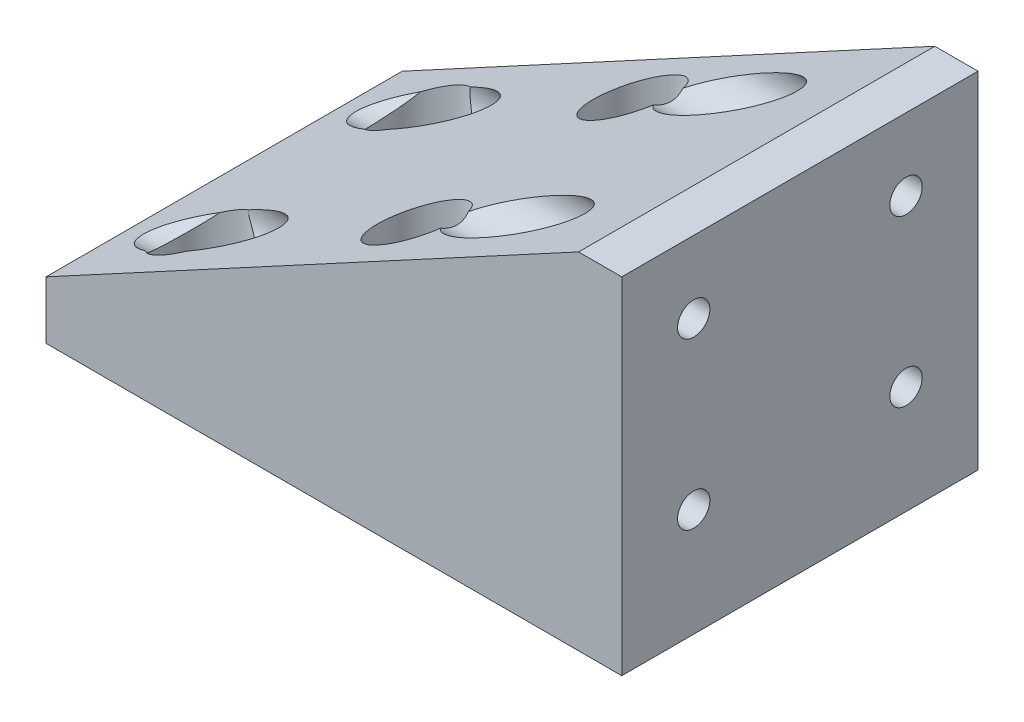
from build123d import *

# Parameters (mm, degrees)
BOSS_EXTRUDE1_DEPTH                           = 40
BOSS_EXTRUDE1_DEPTH_BACK                      = 8
SKETCH1_W                                     = 80
SKETCH1_H                                     = 49.5
CHAMFER1_SIZE                                 = 40
CHAMFER1_SIZE2                                = 74
CSK_FOR_M4_SFHCS1_AT_2_COUNT                  = 2
CSK_FOR_M4_SFHCS1_AT_2_PITCH                  = 30
CSK_FOR_M4_SFHCS1_AT_3_COUNT                  = 2
CSK_FOR_M4_SFHCS1_AT_3_PITCH                  = 42.426406871
CSK_FOR_M4_SFHCS1_AT_4_COUNT                  = 2
CSK_FOR_M4_SFHCS1_AT_4_PITCH                  = 30
SKETCH4_R                                     = 5.48
CUT_EXTRUDE1_DEPTH                            = 62.745951284
CSK_FOR_8_FLAT_HEAD_MACHINE_SCREW1_AT_2_COUNT = 2
CSK_FOR_8_FLAT_HEAD_MACHINE_SCREW1_AT_2_PITCH = 29.5
CSK_FOR_8_FLAT_HEAD_MACHINE_SCREW1_AT_3_COUNT = 2
CSK_FOR_8_FLAT_HEAD_MACHINE_SCREW1_AT_3_PITCH = 37.406550229
CSK_FOR_8_FLAT_HEAD_MACHINE_SCREW1_AT_4_COUNT = 2
CSK_FOR_8_FLAT_HEAD_MACHINE_SCREW1_AT_4_PITCH = 23
SKETCH7_R                                     = 5.0856896
CUT_EXTRUDE2_DEPTH                            = 87.842170056


with BuildPart() as part:
    # Sketch1 → Boss-Extrude1 (new, two sides: drawn at the far end of the back side and taken through both)
    with BuildSketch(Plane(origin=(0, 0, 0), x_dir=(1, 0, 0), z_dir=(0, 1, 0)).offset(-BOSS_EXTRUDE1_DEPTH_BACK)):
        Rectangle(SKETCH1_W, SKETCH1_H)
    extrude(amount=BOSS_EXTRUDE1_DEPTH + BOSS_EXTRUDE1_DEPTH_BACK)

    # Chamfer1
    chamfer1_edges = [part.edges().sort_by_distance(p)[0] for p in [
        (-40, 40, 0),
    ]]
    chamfer1_side = [part.faces().sort_by_distance(p)[0] for p in [
        (-40, 16, 0),
    ]]
    chamfer(chamfer1_edges, length=CHAMFER1_SIZE, length2=CHAMFER1_SIZE2, reference=chamfer1_side[0])

    # Sketch3 → CSK for M4 SFHCS1 (revolve, cut)
    with BuildSketch(Plane(origin=(-28.25, 0, -15), x_dir=(0, 0, 1), z_dir=(1, 0, 0))):
        Polygon((0, 0), (0, 8), (2.25, 8), (2.25, 3.23), (5.48, 0), align=None)
    csk_for_m4_sfhcs1 = revolve(axis=Axis((-28.25, 6.35, -15), (0, -1, 0)), mode=Mode.SUBTRACT)

    # CSK for M4 SFHCS1 at 2: CSK for M4 SFHCS1 ×2
    with Locations(*[(i * CSK_FOR_M4_SFHCS1_AT_2_PITCH, 0, 0) for i in range(1, CSK_FOR_M4_SFHCS1_AT_2_COUNT)]):
        add(csk_for_m4_sfhcs1, mode=Mode.SUBTRACT)

    # CSK for M4 SFHCS1 at 3: CSK for M4 SFHCS1 ×2
    with Locations(*[Vector(0.7071067811865476, 0, 0.7071067811865476) * (i * CSK_FOR_M4_SFHCS1_AT_3_PITCH) for i in range(1, CSK_FOR_M4_SFHCS1_AT_3_COUNT)]):
        add(csk_for_m4_sfhcs1, mode=Mode.SUBTRACT)

    # CSK for M4 SFHCS1 at 4: CSK for M4 SFHCS1 ×2
    with Locations(*[(0, 0, i * CSK_FOR_M4_SFHCS1_AT_4_PITCH) for i in range(1, CSK_FOR_M4_SFHCS1_AT_4_COUNT)]):
        add(csk_for_m4_sfhcs1, mode=Mode.SUBTRACT)

    # Sketch4 → Cut-Extrude1 (cut, through all)
    with BuildSketch(Plane.XZ):
        with Locations((-28.25, -15)):
            Circle(SKETCH4_R)
        with Locations((1.75, -15)):
            Circle(SKETCH4_R)
        with Locations((1.75, 15)):
            Circle(SKETCH4_R)
        with Locations((-28.25, 15)):
            Circle(SKETCH4_R)
    extrude(amount=-CUT_EXTRUDE1_DEPTH, mode=Mode.SUBTRACT)

    # Sketch6 → CSK for #8 Flat Head Machine Screw1 (revolve, cut)
    with BuildSketch(Plane(origin=(33, 30, 14.75), x_dir=(0, 0, 1), z_dir=(0, 1, 0))):
        Polygon((0, 0), (0, 7), (2.2479, 7), (2.2479, 3.264503502), (5.0856896, 0), align=None)
    csk_for_8_flat_head_machine_screw1 = revolve(axis=Axis((26.65, 30, 14.75), (1, 0, 0)), mode=Mode.SUBTRACT)

    # CSK for #8 Flat Head Machine Screw1 at 2: CSK for #8 Flat Head Machine Screw1 ×2
    with Locations(*[(0, 0, -i * CSK_FOR_8_FLAT_HEAD_MACHINE_SCREW1_AT_2_PITCH) for i in range(1, CSK_FOR_8_FLAT_HEAD_MACHINE_SCREW1_AT_2_COUNT)]):
        add(csk_for_8_flat_head_machine_screw1, mode=Mode.SUBTRACT)

    # CSK for #8 Flat Head Machine Screw1 at 3: CSK for #8 Flat Head Machine Screw1 ×2
    with Locations(*[Vector(0, -0.6148655745980577, -0.7886319326366391) * (i * CSK_FOR_8_FLAT_HEAD_MACHINE_SCREW1_AT_3_PITCH) for i in range(1, CSK_FOR_8_FLAT_HEAD_MACHINE_SCREW1_AT_3_COUNT)]):
        add(csk_for_8_flat_head_machine_screw1, mode=Mode.SUBTRACT)

    # CSK for #8 Flat Head Machine Screw1 at 4: CSK for #8 Flat Head Machine Screw1 ×2
    with Locations(*[(0, -i * CSK_FOR_8_FLAT_HEAD_MACHINE_SCREW1_AT_4_PITCH, 0) for i in range(1, CSK_FOR_8_FLAT_HEAD_MACHINE_SCREW1_AT_4_COUNT)]):
        add(csk_for_8_flat_head_machine_screw1, mode=Mode.SUBTRACT)

    # Sketch7 → Cut-Extrude2 (cut, through all)
    with BuildSketch(Plane(origin=(33, 0, 0), x_dir=(0, 0, -1), z_dir=(1, 0, 0))):
        with Locations((-14.75, 7)):
            Circle(SKETCH7_R)
        with Locations((14.75, 7)):
            Circle(SKETCH7_R)
        with Locations((14.75, 30)):
            Circle(SKETCH7_R)
        with Locations((-14.75, 30)):
            Circle(SKETCH7_R)
    extrude(amount=-CUT_EXTRUDE2_DEPTH, mode=Mode.SUBTRACT)


solid = part.part
